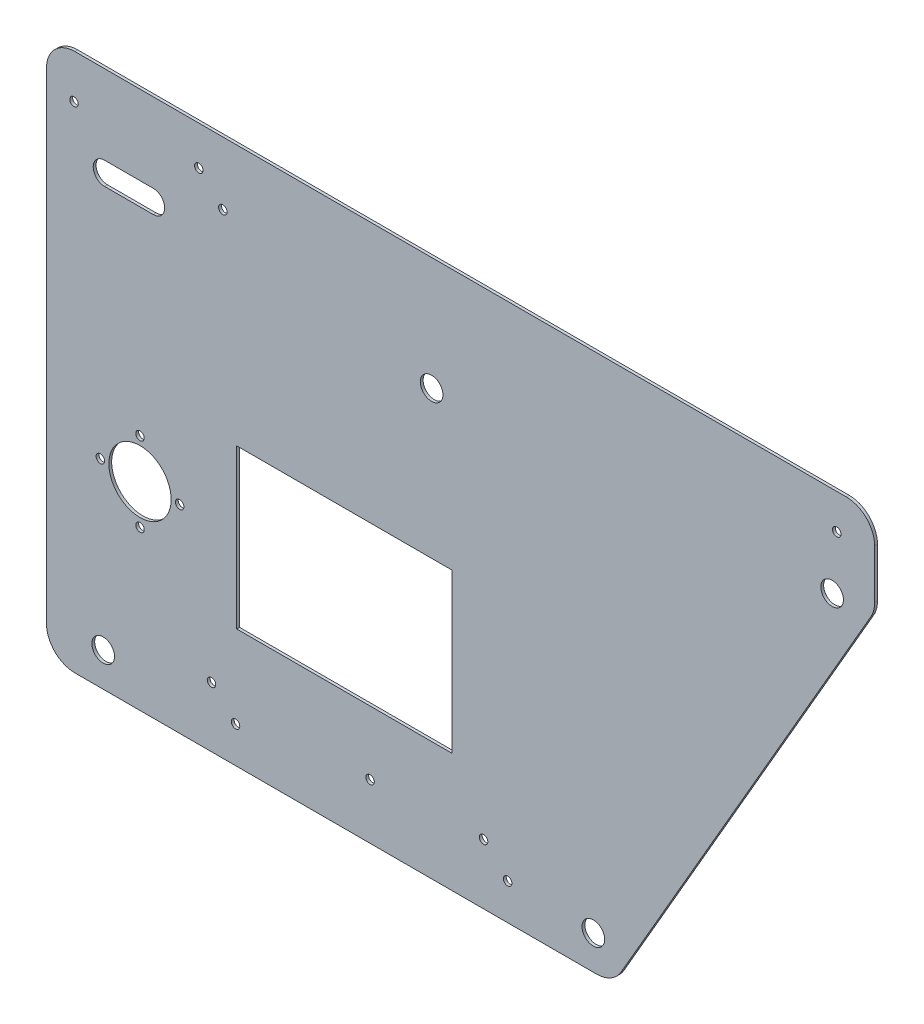
from build123d import *

# Parameters (mm, degrees)
BOSS_EXTRUDE1_DEPTH = 1
FILLET1_R           = 10
SKETCH2_R           = 4
SKETCH2_R_2         = 11
SKETCH2_R_3         = 1.5
SKETCH2_W           = 76
SKETCH2_H           = 56
CUT_EXTRUDE1_DEPTH  = 3


with BuildPart() as part:
    # Sketch1 → Boss-Extrude1 (new body)
    with BuildSketch(Plane.XY):
        Polygon((-100, 110), (-100, -80), (100, -80), (192.37604307, 80), (192.37604307, 110), align=None)
    extrude(amount=BOSS_EXTRUDE1_DEPTH)

    # Fillet1
    fillet1_edges = [part.edges().sort_by_distance(p)[0] for p in [
        (100, -80, 0.5),
        (-100, -80, 0.5),
        (192.37604307, 110, 0.5),
        (-100, 110, 0.5),
        (192.37604307, 80, 0.5),
    ]]
    fillet(fillet1_edges, radius=FILLET1_R)

    # Sketch2 → Cut-Extrude1 (cut)
    with BuildSketch(Plane.XY.offset(1)):
        with Locations((93.07179677, -68)):
            Circle(SKETCH2_R)
        with Locations((177.364936071, 78)):
            Circle(SKETCH2_R)
        with Locations((-67, -10)):
            Circle(SKETCH2_R_2)
        with Locations((-80, -68)):
            Circle(SKETCH2_R)
        with Locations((-53, -10)):
            Circle(SKETCH2_R_3)
        with Locations((-67, 4)):
            Circle(SKETCH2_R_3)
        with Locations((-81, -10)):
            Circle(SKETCH2_R_3)
        with Locations((-67, -24)):
            Circle(SKETCH2_R_3)
        with Locations((35.957265033, 70)):
            Circle(SKETCH2_R)
        with Locations((62.79605759, -67.242640687)):
            Circle(SKETCH2_R_3)
        with Locations((54.310776216, -58.757359313)):
            Circle(SKETCH2_R_3)
        with Locations((-33.274226936, -67.242640687)):
            Circle(SKETCH2_R_3)
        with Locations((-41.75950831, -58.757359313)):
            Circle(SKETCH2_R_3)
        with Locations((14.225855729, -60.5)):
            Circle(SKETCH2_R_3)
        with Locations((-37.754710439, 87.757359313)):
            Circle(SKETCH2_R_3)
        with Locations((-46.239991813, 96.242640687)):
            Circle(SKETCH2_R_3)
        with Locations((-90.295627115, 94.5)):
            Circle(SKETCH2_R_3)
        with Locations((178.99327299, 97.609508858)):
            Circle(SKETCH2_R_3)
        with BuildLine():
            Line((-79.516586773, 82), (-62.300333374, 82))
            ThreePointArc((-62.300333374, 82), (-58.300333374, 78), (-62.300333374, 74))
            Line((-62.300333374, 74), (-79.516586773, 74))
            ThreePointArc((-79.516586773, 74), (-83.516586773, 78), (-79.516586773, 82))
        make_face()
        with Locations((5.141640745, -10)):
            Rectangle(SKETCH2_W, SKETCH2_H)
    extrude(amount=-CUT_EXTRUDE1_DEPTH, mode=Mode.SUBTRACT)


solid = part.part
